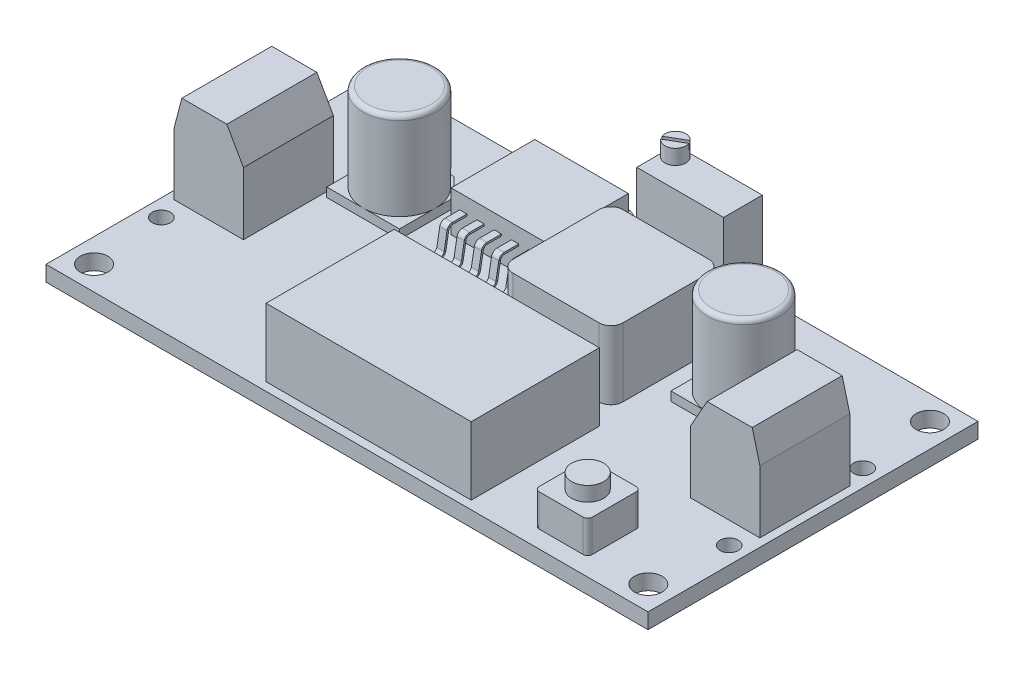
from build123d import *

# Parameters (mm, degrees)
SKETCH1_W                  = 66.26
SKETCH1_H                  = 36.32
BOSS_EXTRUDE1_DEPTH        = 1.7
SKETCH2_R                  = 1.52
SKETCH2_R_2                = 1
CUT_EXTRUDE1_DEPTH         = 38.818943666
SKETCH3_W                  = 7.62
SKETCH3_H                  = 9.9
BOSS_EXTRUDE2_DEPTH        = 10.1
CUT_EXTRUDE2_DEPTH         = 43.082169621
BOSS_EXTRUDE3_DEPTH        = 1
SKETCH6_R                  = 4
BOSS_EXTRUDE4_DEPTH        = 9.64
FILLET1_R                  = 0.5
SKETCH7_W                  = 12.1
SKETCH7_H                  = 12.1
BOSS_EXTRUDE5_DEPTH        = 7.54
BOSS_EXTRUDE6_DEPTH        = 7.54
BOSS_EXTRUDE6_2_OUTLINE_W  = 22.58
BOSS_EXTRUDE6_2_OUTLINE_H  = 14.1
BOSS_EXTRUDE6_2_DEPTH      = 7.48
SKETCH9_W                  = 9.56
SKETCH9_H                  = 4.26
BOSS_EXTRUDE7_DEPTH        = 10.2
SKETCH10_R                 = 1.15
BOSS_EXTRUDE8_DEPTH        = 1.64
CUT_EXTRUDE3_START         = -0.68
CUT_EXTRUDE3_DEPTH         = 0.68
SKETCH12_W                 = 5.84
SKETCH12_H                 = 5.84
BOSS_EXTRUDE9_DEPTH        = 3.56
BOSS_EXTRUDE10_START       = -3.56
BOSS_EXTRUDE10_DEPTH       = 3.56
BOSS_EXTRUDE10_2_OUTLINE_R = 1.76
BOSS_EXTRUDE10_2_DEPTH     = 1.6
BOSS_EXTRUDE11_DEPTH       = 4.46
CUT_EXTRUDE4_DEPTH         = 3.32
SKETCH17_W                 = 0.8
SKETCH17_H                 = 0.2
LPATTERN1_COUNT            = 3
LPATTERN1_PITCH            = 1.9
LPATTERN1_COL_COUNT        = 3
LPATTERN1_COL_PITCH        = 1.9


# Read off the part's stored shape, not the designer's step: Boss-Extrude6, Boss-Extrude10
with BuildPart() as part:
    # Sketch1 → Boss-Extrude1 (new body)
    with BuildSketch(Plane(origin=(0, 0, 0), x_dir=(1, 0, 0), z_dir=(0, 1, 0))):
        Rectangle(SKETCH1_W, SKETCH1_H)
    extrude(amount=BOSS_EXTRUDE1_DEPTH)

    # Sketch2 → Cut-Extrude1 (cut, through all)
    with BuildSketch(Plane(origin=(0, 1.7, 0), x_dir=(1, 0, 0), z_dir=(0, 1, 0))):
        with Locations(Location((-30.5, 15.5, 0), (0, 0, 270))):
            Circle(SKETCH2_R)
        with Locations(Location((30.5, 15.5, 0), (0, 0, 270))):
            Circle(SKETCH2_R)
        with Locations(Location((30.5, -15.5, 0), (0, 0, 270))):
            Circle(SKETCH2_R)
        with Locations(Location((-30.5, -15.5, 0), (0, 0, 270))):
            Circle(SKETCH2_R)
        with Locations(Location((-31.25, 7.35, 0), (0, 0, 270))):
            Circle(SKETCH2_R_2)
        with Locations(Location((-31.25, -7.35, 0), (0, 0, 270))):
            Circle(SKETCH2_R_2)
        with Locations(Location((31.25, -7.35, 0), (0, 0, 270))):
            Circle(SKETCH2_R_2)
        with Locations(Location((31.25, 7.35, 0), (0, 0, 270))):
            Circle(SKETCH2_R_2)
    extrude(amount=-CUT_EXTRUDE1_DEPTH, mode=Mode.SUBTRACT)

    # Sketch3 → Boss-Extrude2 (add)
    with BuildSketch(Plane(origin=(0, 1.7, 0), x_dir=(1, 0, 0), z_dir=(0, 1, 0))):
        with Locations((-28.42, 0)):
            Rectangle(SKETCH3_W, SKETCH3_H)
    boss_extrude2 = extrude(amount=BOSS_EXTRUDE2_DEPTH)

    # Sketch4 → Cut-Extrude2 (cut, through all)
    with BuildSketch(Plane.XY.offset(4.95)):
        Polygon((-32.23, 8.58), (-31.39, 11.8), (-32.23, 11.8), align=None)
        Polygon((-24.61, 11.8), (-26.43, 11.8), (-24.61, 8.58), align=None)
    cut_extrude2 = extrude(amount=-CUT_EXTRUDE2_DEPTH, mode=Mode.SUBTRACT)

    # Mirror1: Boss-Extrude2, Cut-Extrude2 across plane
    add(boss_extrude2.mirror(Plane(origin=(0, 0, 0), x_dir=(0, 0, 1), z_dir=(1, 0, 0))))
    add(cut_extrude2.mirror(Plane(origin=(0, 0, 0), x_dir=(0, 0, 1), z_dir=(1, 0, 0))), mode=Mode.SUBTRACT)

    # Sketch5 → Boss-Extrude3 (add)
    with BuildSketch(Plane(origin=(0, 1.7, 0), x_dir=(1, 0, 0), z_dir=(0, 1, 0))):
        Polygon((-18.05, 11.66), (-16.05, 9.66), (-16.05, 3.66), (-24.05, 3.66), (-24.05, 9.66), (-22.05, 11.66), align=None)
        Polygon((16.33, 11.16), (20.33, 11.16), (22.33, 9.16), (22.33, 3.16), (14.33, 3.16), (14.33, 9.16), align=None)
    extrude(amount=BOSS_EXTRUDE3_DEPTH)

    # Sketch6 → Boss-Extrude4 (add)
    with BuildSketch(Plane(origin=(0, 2.7, 0), x_dir=(1, 0, 0), z_dir=(0, 1, 0))):
        with Locations(Location((-20.05, 7.66, 0), (0, 0, 270))):
            Circle(SKETCH6_R)
        with Locations(Location((18.33, 7.16, 0), (0, 0, 270))):
            Circle(SKETCH6_R)
    extrude(amount=BOSS_EXTRUDE4_DEPTH)

    # Fillet1
    fillet1_edges = [part.edges().sort_by_distance(p)[0] for p in [
        (-20.05, 12.34, -11.66),
        (18.33, 12.34, -11.16),
    ]]
    fillet(fillet1_edges, radius=FILLET1_R)

    # Sketch7 → Boss-Extrude5 (add)
    with BuildSketch(Plane(origin=(0, 1.7, 0), x_dir=(1, 0, 0), z_dir=(0, 1, 0))):
        with Locations((5.68, 5.21)):
            Rectangle(SKETCH7_W, SKETCH7_H)
    extrude(amount=BOSS_EXTRUDE5_DEPTH)

    # Boss-Extrude6 outline → Boss-Extrude6 (cut)
    with BuildSketch(Plane(origin=(0, 1.7, 0), x_dir=(1, 0, 0), z_dir=(0, 1, 0))):
        with BuildLine():
            Line((-0.37, 11.26), (-0.37, 9.96))
            ThreePointArc((-0.37, 9.96), (0.010761184, 10.879238816), (0.93, 11.26))
            Line((0.93, 11.26), (-0.37, 11.26))
        make_face()
        with BuildLine():
            ThreePointArc((0.93, -0.84), (0.010761184, -0.459238816), (-0.37, 0.46))
            Line((-0.37, 0.46), (-0.37, -0.84))
            Line((-0.37, -0.84), (0.93, -0.84))
        make_face()
        with BuildLine():
            Line((11.73, 11.26), (10.43, 11.26))
            ThreePointArc((10.43, 11.26), (11.349238816, 10.879238816), (11.73, 9.96))
            Line((11.73, 9.96), (11.73, 11.26))
        make_face()
        with BuildLine():
            ThreePointArc((11.73, 0.46), (11.349238816, -0.459238816), (10.43, -0.84))
            Line((10.43, -0.84), (11.73, -0.84))
            Line((11.73, -0.84), (11.73, 0.46))
        make_face()
    extrude(amount=BOSS_EXTRUDE6_DEPTH, mode=Mode.SUBTRACT)

    # Boss-Extrude6 2 outline → Boss-Extrude6 2 (add)
    with BuildSketch(Plane(origin=(0, 1.7, 0), x_dir=(1, 0, 0), z_dir=(0, 1, 0))):
        with Locations((1.46, -10.19)):
            Rectangle(BOSS_EXTRUDE6_2_OUTLINE_W, BOSS_EXTRUDE6_2_OUTLINE_H)
    extrude(amount=BOSS_EXTRUDE6_2_DEPTH)

    # Sketch9 → Boss-Extrude7 (add)
    with BuildSketch(Plane(origin=(0, 1.7, 0), x_dir=(1, 0, 0), z_dir=(0, 1, 0))):
        with Locations((5.11, 15.53)):
            Rectangle(SKETCH9_W, SKETCH9_H)
    extrude(amount=BOSS_EXTRUDE7_DEPTH)

    # Sketch10 → Boss-Extrude8 (add)
    with BuildSketch(Plane(origin=(0, 11.9, 0), x_dir=(1, 0, 0), z_dir=(0, 1, 0))):
        with Locations(Location((1.48, 16.51, 0), (0, 0, 90))):
            Circle(SKETCH10_R)
    extrude(amount=BOSS_EXTRUDE8_DEPTH)

    # Sketch11 → Cut-Extrude3 (cut)
    with BuildSketch(Plane(origin=(0, 13.54, 0), x_dir=(1, 0, 0), z_dir=(0, 1, 0)).offset(CUT_EXTRUDE3_START)):
        with BuildLine():
            Line((0.399247738, 16.116967498), (2.360752262, 17.249442663))
            ThreePointArc((2.360752262, 17.249442663), (2.475929214, 17.085), (2.560752262, 16.903032502))
            Line((2.560752262, 16.903032502), (0.599247738, 15.770557337))
            ThreePointArc((0.599247738, 15.770557337), (0.484070786, 15.935), (0.399247738, 16.116967498))
        make_face()
    extrude(amount=CUT_EXTRUDE3_DEPTH, mode=Mode.SUBTRACT)

    # Sketch12 → Boss-Extrude9 (add)
    with BuildSketch(Plane(origin=(0, 1.7, 0), x_dir=(1, 0, 0), z_dir=(0, 1, 0))):
        with Locations((21.67, -13.34)):
            Rectangle(SKETCH12_W, SKETCH12_H)
    extrude(amount=BOSS_EXTRUDE9_DEPTH)

    # Boss-Extrude10 outline → Boss-Extrude10 (cut)
    with BuildSketch(Plane(origin=(0, 5.26, 0), x_dir=(1, 0, 0), z_dir=(0, 1, 0)).offset(BOSS_EXTRUDE10_START)):
        with BuildLine():
            Line((24.59, -10.42), (24.09, -10.42))
            ThreePointArc((24.09, -10.42), (24.443553391, -10.566446609), (24.59, -10.92))
            Line((24.59, -10.92), (24.59, -10.42))
        make_face()
        with BuildLine():
            ThreePointArc((18.75, -10.92), (18.896446609, -10.566446609), (19.25, -10.42))
            Line((19.25, -10.42), (18.75, -10.42))
            Line((18.75, -10.42), (18.75, -10.92))
        make_face()
        with BuildLine():
            Line((24.59, -16.26), (24.59, -15.76))
            ThreePointArc((24.59, -15.76), (24.443553391, -16.113553391), (24.09, -16.26))
            Line((24.09, -16.26), (24.59, -16.26))
        make_face()
        with BuildLine():
            ThreePointArc((19.25, -16.26), (18.896446609, -16.113553391), (18.75, -15.76))
            Line((18.75, -15.76), (18.75, -16.26))
            Line((18.75, -16.26), (19.25, -16.26))
        make_face()
    extrude(amount=BOSS_EXTRUDE10_DEPTH, mode=Mode.SUBTRACT)

    # Boss-Extrude10 2 outline → Boss-Extrude10 2 (add)
    with BuildSketch(Plane(origin=(0, 5.26, 0), x_dir=(1, 0, 0), z_dir=(0, 1, 0))):
        with Locations((21.67, -13.34)):
            Circle(BOSS_EXTRUDE10_2_OUTLINE_R)
    extrude(amount=BOSS_EXTRUDE10_2_DEPTH)

    # Sketch14 → Boss-Extrude11 (add)
    with BuildSketch(Plane(origin=(0, 1.7, 0), x_dir=(1, 0, 0), z_dir=(0, 1, 0))):
        Polygon((-13.67, 17.32), (-13.67, 6.96), (-3.37, 6.96), (-3.37, 17.32), (-4.93, 17.96), (-12.11, 17.96), align=None)
    extrude(amount=BOSS_EXTRUDE11_DEPTH)

    # Sketch15 → Cut-Extrude4 (cut)
    with BuildSketch(Plane(origin=(0, 6.16, 0), x_dir=(1, 0, 0), z_dir=(0, 1, 0))):
        Polygon((-13.67, 16.18), (-3.37, 16.18), (-3.37, 17.32), (-4.93, 17.96), (-12.11, 17.96), (-13.67, 17.32), align=None)
    extrude(amount=-CUT_EXTRUDE4_DEPTH, mode=Mode.SUBTRACT)

    # Sweep1: sweep along a path in Sketch16
    with BuildLine(Plane.ZY.offset(8.52)) as sweep1_path:
        Line((-6.96, 4.44), (-5.36, 4.44))
        ThreePointArc((-5.36, 4.44), (-5.038606195, 4.323022222), (-4.867596123, 4.026824089))
        Line((-4.867596123, 4.026824089), (-4.547801016, 2.213175911))
        ThreePointArc((-4.547801016, 2.213175911), (-4.376790945, 1.916977778), (-4.05539714, 1.8))
        Line((-4.05539714, 1.8), (-3.26, 1.8))
    # Sketch17 → Sweep1 (sweep)
    with BuildSketch(Plane.XY.offset(-6.96)):
        with Locations((-8.52, 4.44)):
            Rectangle(SKETCH17_W, SKETCH17_H)
    sweep1 = sweep(path=sweep1_path.line)

    # LPattern1: Sweep1 ×3
    with Locations(*[(i * LPATTERN1_PITCH, 0, 0) for i in range(1, LPATTERN1_COUNT)]):
        add(sweep1)

    # LPattern1 col: Sweep1 ×3
    with Locations(*[(-i * LPATTERN1_COL_PITCH, 0, 0) for i in range(1, LPATTERN1_COL_COUNT)]):
        add(sweep1)


solid = part.part
